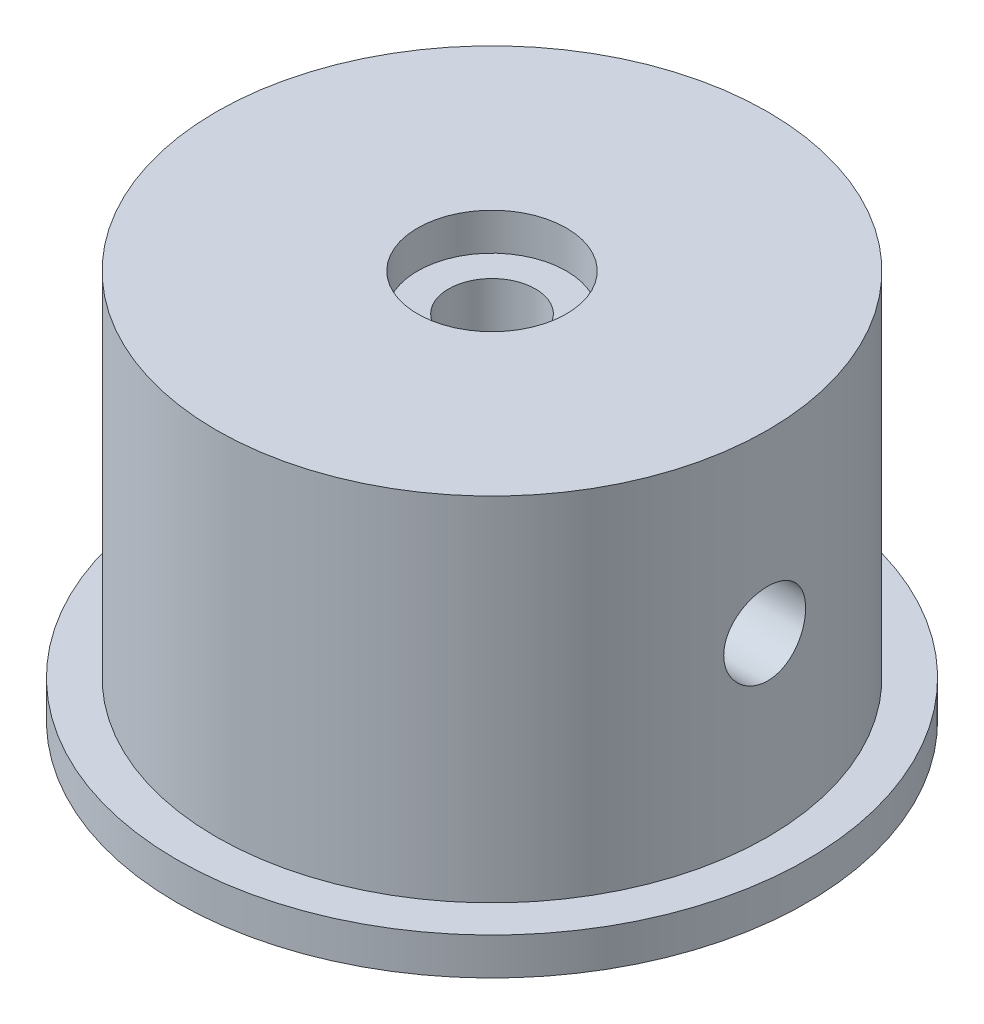
from build123d import *

# Parameters (mm, degrees)
CUT_EXTRUDE1_REACH = 29.896
CUT_EXTRUDE1_START = -5
SKETCH2_R          = 1.65


with BuildPart() as part:
    # Sketch1 → Revolve1 (revolve)
    with BuildSketch(Plane(origin=(0, 0, 0), x_dir=(0, 0, -1), z_dir=(1, 0, 0))):
        Polygon((-1.75, 0), (-3, 0), (-3, -1.5), (-12.7, -1.5), (-12.7, 0), (-11.1125, 0), (-11.1125, 14.2), (-3, 14.2), (-3, 12.7), (-1.75, 12.7), align=None)
    revolve(axis=Axis((0, -1000, 0), (0, 1, 0)))

    # Sketch2 → Cut-Extrude1 (cut, up to next)
    with BuildSketch(Plane(origin=(0, 0, 0), x_dir=(0, 0, -1), z_dir=(1, 0, 0)).offset(CUT_EXTRUDE1_START), mode=Mode.PRIVATE) as cut_extrude1_sk1:
        with Locations((0, 7.1)):
            Circle(SKETCH2_R)
    cut_extrude1_tool1 = extrude(cut_extrude1_sk1.sketch, amount=-CUT_EXTRUDE1_REACH, mode=Mode.PRIVATE) & part.part
    cut_extrude1 = cut_extrude1_tool1.solids().sort_by_distance((-5, 7.1, 0))[0]
    add(cut_extrude1, mode=Mode.SUBTRACT)

    # Mirror1: Cut-Extrude1 across plane
    add(cut_extrude1.mirror(Plane(origin=(0, 0, 0), x_dir=(0, 0, 1), z_dir=(1, 0, 0))), mode=Mode.SUBTRACT)


solid = part.part
